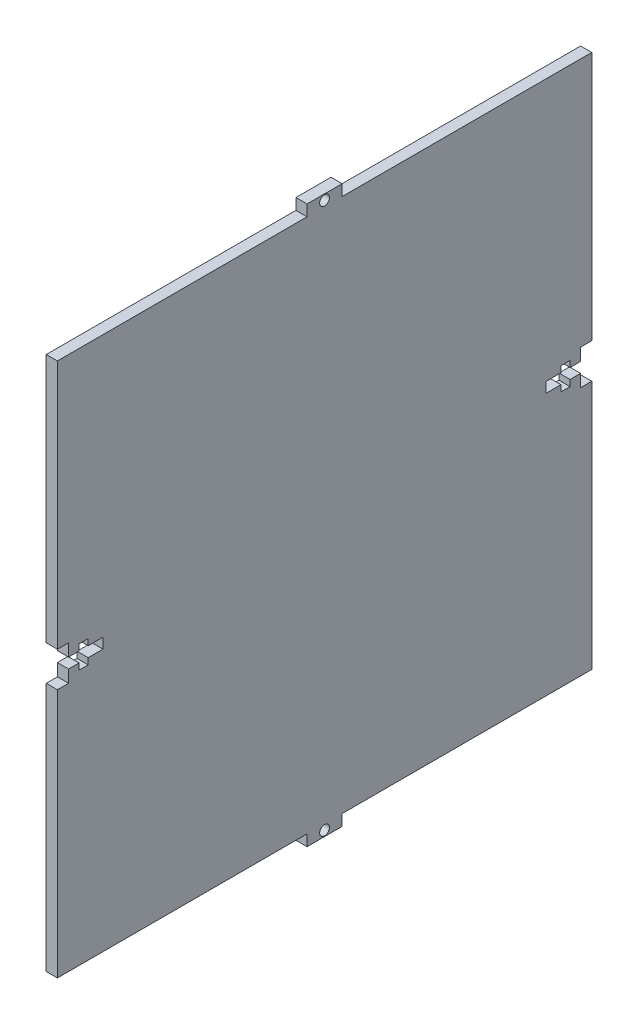
from build123d import *

# Parameters (mm, degrees)
SKETCH1_W           = 152.4
SKETCH1_H           = 152.4
BOSS_EXTRUDE1_DEPTH = 3.18
SKETCH3_W           = 10
SKETCH3_H           = 3.18
SKETCH3_R           = 1.4
BOSS_EXTRUDE5_DEPTH = 3.18
CUT_EXTRUDE2_DEPTH  = 111.080592295
CUT_EXTRUDE3_DEPTH  = 111.080592295


with BuildPart() as part:
    # Sketch1 → Boss-Extrude1 (new body)
    with BuildSketch(Plane(origin=(0, 0, 0), x_dir=(0, 0, -1), z_dir=(1, 0, 0))):
        Rectangle(SKETCH1_W, SKETCH1_H)
    extrude(amount=BOSS_EXTRUDE1_DEPTH)

    # Sketch3 → Boss-Extrude5 (add)
    # profile 1 of 2: a face of its own
    with BuildSketch(Plane.ZY):
        with Locations((0, -77.79)):
            Rectangle(SKETCH3_W, SKETCH3_H)
        with Locations((0, -77.79)):
            Circle(SKETCH3_R, mode=Mode.SUBTRACT)
    # profile 2 of 2: a face of its own
    with BuildSketch(Plane.ZY):
        with Locations((0, 77.79)):
            Rectangle(SKETCH3_W, SKETCH3_H)
        with Locations((0, 77.79)):
            Circle(SKETCH3_R, mode=Mode.SUBTRACT)
    extrude(amount=-BOSS_EXTRUDE5_DEPTH)

    # Sketch4 → Cut-Extrude2 (cut, through all)
    with BuildSketch(Plane(origin=(0, 0, 0), x_dir=(0, 0, -1), z_dir=(1, 0, 0))):
        Polygon((-76.2, -5), (-76.2, 5), (-73.02, 5), (-73.02, 1.47), (-70.02, 1.47), (-70.02, 3.25), (-67.42, 3.25), (-67.42, 1.47), (-63.2, 1.47), (-63.2, -1.47), (-67.42, -1.47), (-67.42, -3.25), (-70.02, -3.25), (-70.02, -1.47), (-73.02, -1.47), (-73.02, -5), align=None)
    extrude(amount=CUT_EXTRUDE2_DEPTH, mode=Mode.SUBTRACT)

    # Sketch5 → Cut-Extrude3 (cut, through all)
    with BuildSketch(Plane.ZY):
        Polygon((-70.02, -1.47), (-73.02, -1.47), (-73.02, -5), (-76.2, -5), (-76.2, 5), (-73.02, 5), (-73.02, 1.47), (-70.02, 1.47), (-70.02, 3.25), (-67.42, 3.25), (-67.42, 1.47), (-63.2, 1.47), (-63.2, -1.47), (-67.42, -1.47), (-67.42, -3.25), (-70.02, -3.25), align=None)
    extrude(amount=-CUT_EXTRUDE3_DEPTH, mode=Mode.SUBTRACT)


solid = part.part
